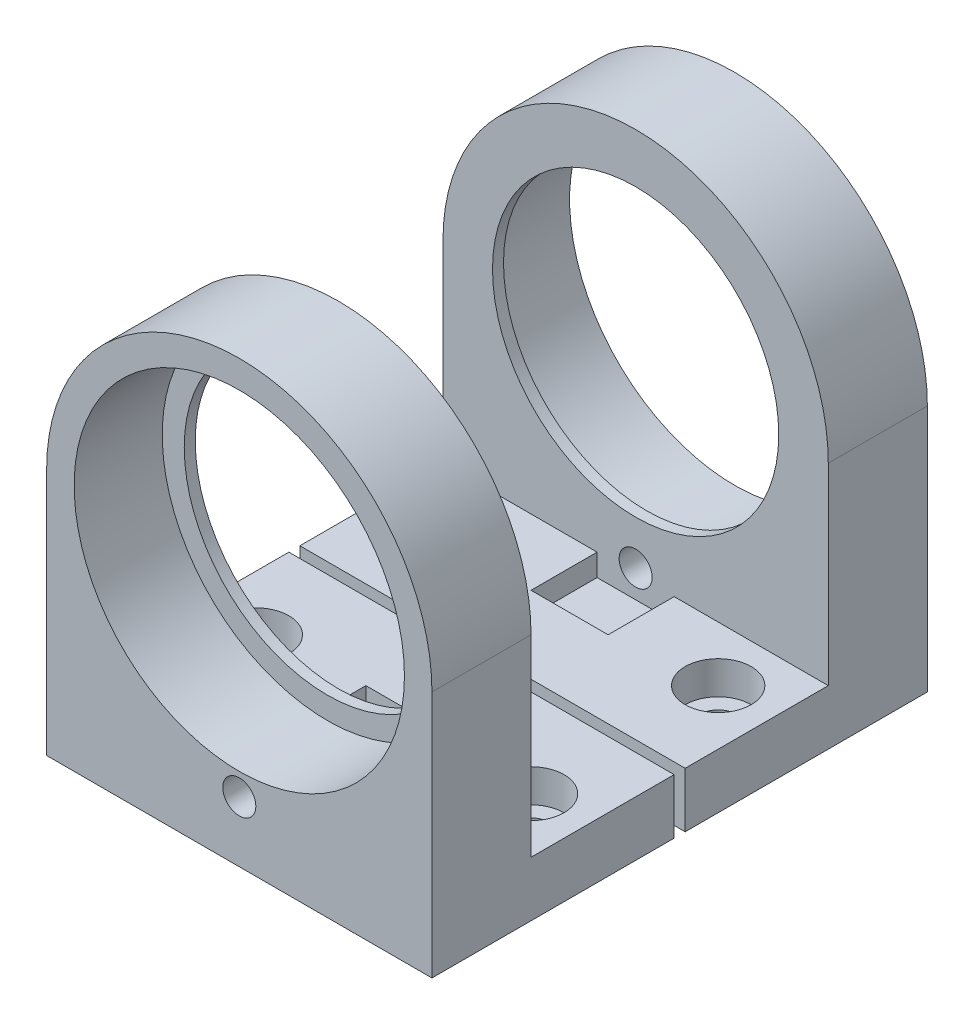
from build123d import *

# Parameters (mm, degrees)
EXTRUDE_1_DEPTH          = 17.5
CUT_EXTRUDE_1_DEPTH      = 63.69968102
CUT_EXTRUDE_1_DEPTH_BACK = 63.69968102
SKETCH_6_R               = 1.55
CUT_EXTRUDE_4_DEPTH      = 46.138675213
SKETCH_7_R               = 15
CUT_EXTRUDE_5_DEPTH      = 8
SKETCH_8_R               = 13
CUT_EXTRUDE_6_DEPTH      = 2
SKETCH_9_R               = 1.5
CUT_EXTRUDE_7_DEPTH      = 14
SKETCH_10_W              = 7
SKETCH_10_H              = 6
CUT_EXTRUDE_8_DEPTH      = 2
SKETCH_15_W              = 35
SKETCH_15_H              = 1
CUT_EXTRUDE_9_DEPTH      = 10
SKETCH_16_R              = 3
CUT_EXTRUDE_10_DEPTH     = 3


with BuildPart() as part:
    # 草图1 → 凸台-拉伸1 (new, symmetric)
    with BuildSketch(Plane(origin=(0, 0, 0), x_dir=(0, 0, -1), z_dir=(1, 0, 0))):
        Polygon((22.5, 0), (-22.5, 0), (-22.5, 40), (-13.5, 40), (-13.5, 5), (13.5, 5), (13.5, 40), (22.5, 40), align=None)
    extrude(amount=EXTRUDE_1_DEPTH, both=True)

    # 草图2 → 切除-拉伸1 (cut, two sides: drawn at the far end of the back side and taken through both)
    with BuildSketch(Plane.XY.offset(22.5).offset(-CUT_EXTRUDE_1_DEPTH_BACK)):
        with BuildLine():
            ThreePointArc((-17.5, 22.5), (-12.374368671, 34.874368671), (0, 40))
            Line((0, 40), (-17.5, 40))
            Line((-17.5, 40), (-17.5, 22.5))
        make_face()
        with BuildLine():
            Line((17.5, 22.5), (17.5, 40))
            Line((17.5, 40), (0, 40))
            ThreePointArc((0, 40), (12.374368671, 34.874368671), (17.5, 22.5))
        make_face()
    extrude(amount=CUT_EXTRUDE_1_DEPTH + CUT_EXTRUDE_1_DEPTH_BACK, mode=Mode.SUBTRACT)

    # 草图6 → 切除-拉伸4 (cut, through all)
    with BuildSketch(Plane(origin=(0, 5, 0), x_dir=(1, 0, 0), z_dir=(0, 1, 0))):
        with Locations((-12.5, 8.5)):
            Circle(SKETCH_6_R)
        with Locations((12.5, 8.5)):
            Circle(SKETCH_6_R)
        with Locations((12.5, -8.5)):
            Circle(SKETCH_6_R)
        with Locations((-12.5, -8.5)):
            Circle(SKETCH_6_R)
    extrude(amount=-CUT_EXTRUDE_4_DEPTH, mode=Mode.SUBTRACT)

    # 草图7 → 切除-拉伸5 (cut)
    with BuildSketch(Plane.XY.offset(22.5)):
        with Locations((0, 22.5)):
            Circle(SKETCH_7_R)
    cut_extrude_5 = extrude(amount=-CUT_EXTRUDE_5_DEPTH, mode=Mode.SUBTRACT)

    # 草图8 → 切除-拉伸6 (cut)
    with BuildSketch(Plane.XY.offset(14.5)):
        with Locations((0, 22.5)):
            Circle(SKETCH_8_R)
    cut_extrude_6 = extrude(amount=-CUT_EXTRUDE_6_DEPTH, mode=Mode.SUBTRACT)

    # 镜向1: 切除-拉伸5, 切除-拉伸6 across plane
    add(cut_extrude_5.mirror(Plane.XY), mode=Mode.SUBTRACT)
    add(cut_extrude_6.mirror(Plane.XY), mode=Mode.SUBTRACT)

    # 草图9 → 切除-拉伸7 (cut)
    with BuildSketch(Plane(origin=(0, 0, -22.5), x_dir=(-1, 0, 0), z_dir=(0, 0, -1))):
        with Locations((0, 5.5)):
            Circle(SKETCH_9_R)
    cut_extrude_7 = extrude(amount=-CUT_EXTRUDE_7_DEPTH, mode=Mode.SUBTRACT)

    # 草图10 → 切除-拉伸8 (cut)
    with BuildSketch(Plane(origin=(0, 5, 0), x_dir=(1, 0, 0), z_dir=(0, 1, 0))):
        with Locations((0, 10.5)):
            Rectangle(SKETCH_10_W, SKETCH_10_H)
    cut_extrude_8 = extrude(amount=-CUT_EXTRUDE_8_DEPTH, mode=Mode.SUBTRACT)

    # 镜向2: 切除-拉伸7, 切除-拉伸8 across plane
    add(cut_extrude_7.mirror(Plane.XY), mode=Mode.SUBTRACT)
    add(cut_extrude_8.mirror(Plane.XY), mode=Mode.SUBTRACT)

    # 草图15 → 切除-拉伸9 (cut)
    with BuildSketch(Plane(origin=(0, 5, 0), x_dir=(1, 0, 0), z_dir=(0, 1, 0))):
        Rectangle(SKETCH_15_W, SKETCH_15_H)
    extrude(amount=-CUT_EXTRUDE_9_DEPTH, mode=Mode.SUBTRACT)


with BuildPart() as cut_extrude_9_piece_1:
    # of the separate pieces the step leaves, piece 1, a body of its own (cut_extrude_9_pieces)
    add(part.part.solids().sort_by_distance((-17.5, 0, -22.5))[0])


with BuildPart() as cut_extrude_9_piece_2:
    # of the separate pieces the step leaves, piece 2, a body of its own (cut_extrude_9_pieces)
    add(part.part.solids().sort_by_distance((17.5, 0, 0.5))[0])


with BuildPart() as cut_extrude_10_tool:
    # 草图16 → 切除-拉伸10 (new body)
    with BuildSketch(Plane(origin=(0, 5, 0), x_dir=(1, 0, 0), z_dir=(0, 1, 0))):
        with Locations((-12.5, 8.5)):
            Circle(SKETCH_16_R)
        with Locations((12.5, 8.5)):
            Circle(SKETCH_16_R)
        with Locations((12.5, -8.5)):
            Circle(SKETCH_16_R)
        with Locations((-12.5, -8.5)):
            Circle(SKETCH_16_R)
    extrude(amount=-CUT_EXTRUDE_10_DEPTH)


with BuildPart() as cut_extrude_9_piece_1_1:
    add(cut_extrude_9_piece_1.part)

    # 切除-拉伸10: cut by cut_extrude_10_tool
    add(cut_extrude_10_tool.part, mode=Mode.SUBTRACT)


with BuildPart() as cut_extrude_9_piece_2_1:
    add(cut_extrude_9_piece_2.part)

    # 切除-拉伸10: cut by cut_extrude_10_tool
    add(cut_extrude_10_tool.part, mode=Mode.SUBTRACT)


solid = Compound([cut_extrude_9_piece_1_1.part, cut_extrude_9_piece_2_1.part])
